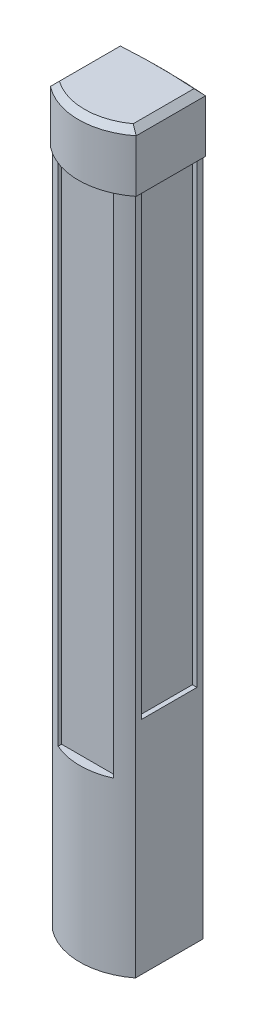
from build123d import *

# Parameters (mm, degrees)
Y_KSEKLIK_EKSTR_ZYON1_DEPTH = 1600
KES_EKSTR_ZYON1_START       = 70
IZIM2_W                     = 120.222043816
IZIM2_H                     = 1105
KES_EKSTR_ZYON1_DEPTH       = 30
IZIM3_W                     = 120.762209075
IZIM3_H                     = 995
KES_EKSTR_ZYON2_DEPTH       = 10
KES_EKSTR_ZYON3_START       = -80
IZIM5_W                     = 120.222043816
IZIM5_H                     = 1000
KES_EKSTR_ZYON3_DEPTH       = 20
Y_KSEKLIK_EKSTR_ZYON3_START = -127
Y_KSEKLIK_EKSTR_ZYON3_DEPTH = 127
PAH1_SIZE                   = 13


with BuildPart() as part:
    # Çizim1 → Yükseklik-Ekstrüzyon1 (new body)
    with BuildSketch(Plane(origin=(0, 0, 0), x_dir=(1, 0, 0), z_dir=(0, 1, 0))):
        with BuildLine():
            Line((90.111021908, 76.625355278), (90.111021908, -59.670974795))
            ThreePointArc((90.111021908, -59.670974795), (0, -90.404100627), (-90.111021908, -59.670974795))
            Line((-90.111021908, -59.670974795), (-90.111021908, 75.941610808))
            Line((-90.111021908, 75.941610808), (-90.111021908, 87.09123428))
            ThreePointArc((-90.111021908, 87.09123428), (0.004425859, 90.403112265), (90.111021908, 86.858565678))
            Line((90.111021908, 86.858565678), (90.111021908, 76.625355278))
        make_face()
    extrude(amount=Y_KSEKLIK_EKSTR_ZYON1_DEPTH)

    # Çizim2 → Kes-Ekstrüzyon1 (cut)
    with BuildSketch(Plane.XY.offset(KES_EKSTR_ZYON1_START)):
        with Locations((0, 922.5)):
            Rectangle(IZIM2_W, IZIM2_H)
    extrude(amount=KES_EKSTR_ZYON1_DEPTH, mode=Mode.SUBTRACT)

    # Çizim3 → Kes-Ekstrüzyon2 (cut)
    with BuildSketch(Plane.ZY.offset(90.111021908)):
        with Locations((-13.710129743, 977.5)):
            Rectangle(IZIM3_W, IZIM3_H)
    kes_ekstr_zyon2 = extrude(amount=-KES_EKSTR_ZYON2_DEPTH, mode=Mode.SUBTRACT)

    # Aynalama1: Kes-Ekstrüzyon2 across plane
    add(kes_ekstr_zyon2.mirror(Plane(origin=(0, 0, 0), x_dir=(0, 0, 1), z_dir=(1, 0, 0))), mode=Mode.SUBTRACT)

    # Çizim5 → Kes-Ekstrüzyon3 (cut)
    with BuildSketch(Plane.XY.offset(KES_EKSTR_ZYON3_START)):
        with Locations((0, 975)):
            Rectangle(IZIM5_W, IZIM5_H)
    extrude(amount=-KES_EKSTR_ZYON3_DEPTH, mode=Mode.SUBTRACT)

    # Çizim6 → Yükseklik-Ekstrüzyon3 (add)
    with BuildSketch(Plane(origin=(0, 1600, 0), x_dir=(1, 0, 0), z_dir=(0, 1, 0)).offset(Y_KSEKLIK_EKSTR_ZYON3_START)):
        with BuildLine():
            Line((-93.111021908, 89.871667708), (-93.111021908, -61.135861665))
            ThreePointArc((-93.111021908, -61.135861665), (0, -93.404100627), (93.111021908, -61.135861665))
            Line((93.111021908, -61.135861665), (93.111021908, 89.631816245))
            ThreePointArc((93.111021908, 89.631816245), (0.004702918, 93.403114402), (-93.111021908, 89.871667708))
        make_face()
        with BuildLine():
            Line((90.111021908, -59.670974795), (90.111021908, 86.858565678))
            ThreePointArc((90.111021908, 86.858565678), (0.004425859, 90.403112265), (-90.111021908, 87.09123428))
            Line((-90.111021908, 87.09123428), (-90.111021908, -59.670974795))
            ThreePointArc((-90.111021908, -59.670974795), (0, -90.404100627), (90.111021908, -59.670974795))
        make_face(mode=Mode.SUBTRACT)
    extrude(amount=Y_KSEKLIK_EKSTR_ZYON3_DEPTH)

    # Pah1
    pah1_edges = [part.edges().sort_by_distance(p)[0] for p in [
        (93.111021908, 1600, -14.24797729),
        (0.004702918, 1600, -93.403114402),
        (-93.111021908, 1600, -14.367903022),
        (0, 1600, 93.404100627),
    ]]
    chamfer(pah1_edges, length=PAH1_SIZE)


solid = part.part
